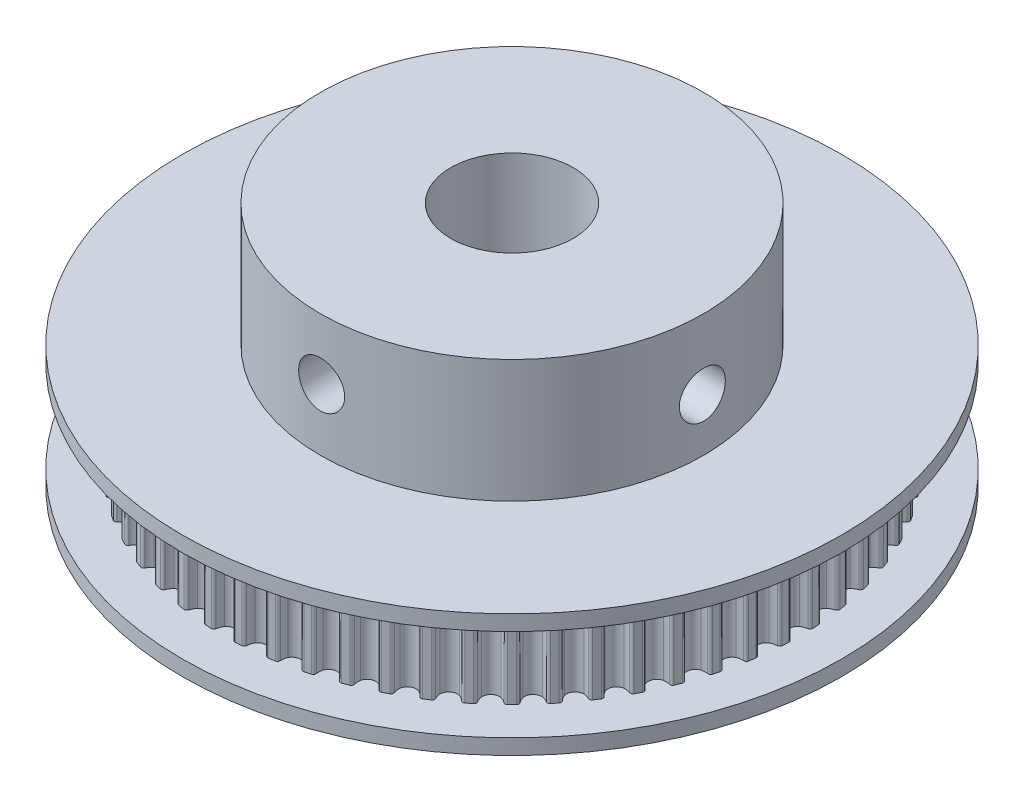
from build123d import *

# Parameters (mm, degrees)
SKETCH1_R                = 18.844609303
BOSS_EXTRUDE1_DEPTH      = 6
CUT_EXTRUDE1_START       = -10
CUT_EXTRUDE1_DEPTH       = 10
FILLET1_R                = 0.17
CIRPATTERN2_COUNT        = 60
FILLET1_OF_CIRPATTERN2_R = 0.17
SKETCH3_R                = 21.5
BOSS_EXTRUDE2_DEPTH      = 1
BOSS_EXTRUDE3_START      = 1
SKETCH4_R                = 21.5
BOSS_EXTRUDE3_DEPTH      = 1
SKETCH5_R                = 12.5
SKETCH5_R_2              = 4
BOSS_EXTRUDE4_DEPTH      = 8
SKETCH6_R                = 4
CUT_EXTRUDE2_DEPTH       = 32.440419981
CUT_EXTRUDE3_REACH       = 44.933
SKETCH7_R                = 1.5
CUT_EXTRUDE4_REACH       = 44.933
SKETCH8_R                = 1.5


with BuildPart() as part:
    # Sketch1 → Boss-Extrude1 (new body)
    with BuildSketch(Plane(origin=(0, 0, 0), x_dir=(1, 0, 0), z_dir=(0, 1, 0))):
        Circle(SKETCH1_R)
    extrude(amount=BOSS_EXTRUDE1_DEPTH)

    # Sketch2 → Cut-Extrude1 (cut)
    with BuildSketch(Plane(origin=(0, 6, 0), x_dir=(1, 0, 0), z_dir=(0, 1, 0)).offset(CUT_EXTRUDE1_START)):
        with BuildLine():
            ThreePointArc((0.453553699, 18.286177496), (0.576034086, 18.548370442), (0.619948996, 18.834409017))
            ThreePointArc((0.619948996, 18.834409017), (0, 18.844609303), (-0.619948996, 18.834409017))
            ThreePointArc((-0.619948996, 18.834409017), (-0.576034086, 18.548370442), (-0.453553699, 18.286177496))
            ThreePointArc((-0.453553699, 18.286177496), (0, 18.064609303), (0.453553699, 18.286177496))
        make_face()
    cut_extrude1 = extrude(amount=CUT_EXTRUDE1_DEPTH, mode=Mode.SUBTRACT)

    # Fillet1
    fillet1_edges = [part.edges().sort_by_distance(p)[0] for p in [
        (0.619948996, 3, -18.834409017),
        (-0.619948996, 3, -18.834409017),
    ]]
    fillet(fillet1_edges, radius=FILLET1_R)

    # CirPattern2: Cut-Extrude1 ×60 about axis
    cirpattern2_axis = Axis((0, 6, 0), (0, -1, 0))
    for i in range(1, CIRPATTERN2_COUNT):
        add(cut_extrude1.rotate(cirpattern2_axis, i * 360 / CIRPATTERN2_COUNT), mode=Mode.SUBTRACT)

    # Fillet1 of CirPattern2
    fillet1_of_cirpattern2_edges = [part.edges().sort_by_distance(p)[0] for p in [
        (2.585284682, 3, -18.666429838),
        (1.352178981, 3, -18.79603447),
        (4.522295447, 3, -18.293937347),
        (3.309492201, 3, -18.551726635),
        (6.409758998, 3, -17.721012651),
        (5.230545933, 3, -18.104162202),
        (8.226995887, 3, -16.953932831),
        (7.094292709, 3, -17.458244778),
        (9.954096088, 3, -16.001102176),
        (8.880312929, 3, -16.621051172),
        (11.572137129, 3, -14.872960097),
        (10.569038583, 3, -15.601753851),
        (13.063391414, 3, -13.581866754),
        (12.141967638, 3, -14.411520449),
        (14.411520449, 3, -12.141967638),
        (13.581866754, 3, -13.063391414),
        (15.601753851, 3, -10.569038583),
        (14.872960097, 3, -11.572137129),
        (16.621051172, 3, -8.880312929),
        (16.001102176, 3, -9.954096088),
        (17.458244778, 3, -7.094292709),
        (16.953932831, 3, -8.226995887),
        (18.104162202, 3, -5.230545933),
        (17.721012651, 3, -6.409758998),
        (18.551726635, 3, -3.309492201),
        (18.293937347, 3, -4.522295447),
        (18.79603447, 3, -1.352178981),
        (18.666429838, 3, -2.585284682),
        (18.834409017, 3, 0.619948996),
        (18.834409017, 3, -0.619948996),
        (18.666429838, 3, 2.585284682),
        (18.79603447, 3, 1.352178981),
        (18.293937347, 3, 4.522295447),
        (18.551726635, 3, 3.309492201),
        (17.721012651, 3, 6.409758998),
        (18.104162202, 3, 5.230545933),
        (16.953932831, 3, 8.226995887),
        (17.458244778, 3, 7.094292709),
        (16.001102176, 3, 9.954096088),
        (16.621051172, 3, 8.880312929),
        (14.872960097, 3, 11.572137129),
        (15.601753851, 3, 10.569038583),
        (13.581866754, 3, 13.063391414),
        (14.411520449, 3, 12.141967638),
        (12.141967638, 3, 14.411520449),
        (13.063391414, 3, 13.581866754),
        (10.569038583, 3, 15.601753851),
        (11.572137129, 3, 14.872960097),
        (8.880312929, 3, 16.621051172),
        (9.954096088, 3, 16.001102176),
        (7.094292709, 3, 17.458244778),
        (8.226995887, 3, 16.953932831),
        (5.230545933, 3, 18.104162202),
        (6.409758998, 3, 17.721012651),
        (3.309492201, 3, 18.551726635),
        (4.522295447, 3, 18.293937347),
        (1.352178981, 3, 18.79603447),
        (2.585284682, 3, 18.666429838),
        (-0.619948996, 3, 18.834409017),
        (0.619948996, 3, 18.834409017),
        (-2.585284682, 3, 18.666429838),
        (-1.352178981, 3, 18.79603447),
        (-4.522295447, 3, 18.293937347),
        (-3.309492201, 3, 18.551726635),
        (-6.409758998, 3, 17.721012651),
        (-5.230545933, 3, 18.104162202),
        (-8.226995887, 3, 16.953932831),
        (-7.094292709, 3, 17.458244778),
        (-9.954096088, 3, 16.001102176),
        (-8.880312929, 3, 16.621051172),
        (-11.572137129, 3, 14.872960097),
        (-10.569038583, 3, 15.601753851),
        (-13.063391414, 3, 13.581866754),
        (-12.141967638, 3, 14.411520449),
        (-14.411520449, 3, 12.141967638),
        (-13.581866754, 3, 13.063391414),
        (-15.601753851, 3, 10.569038583),
        (-14.872960097, 3, 11.572137129),
        (-16.621051172, 3, 8.880312929),
        (-16.001102176, 3, 9.954096088),
        (-17.458244778, 3, 7.094292709),
        (-16.953932831, 3, 8.226995887),
        (-18.104162202, 3, 5.230545933),
        (-17.721012651, 3, 6.409758998),
        (-18.551726635, 3, 3.309492201),
        (-18.293937347, 3, 4.522295447),
        (-18.79603447, 3, 1.352178981),
        (-18.666429838, 3, 2.585284682),
        (-18.834409017, 3, -0.619948996),
        (-18.834409017, 3, 0.619948996),
        (-18.666429838, 3, -2.585284682),
        (-18.79603447, 3, -1.352178981),
        (-18.293937347, 3, -4.522295447),
        (-18.551726635, 3, -3.309492201),
        (-17.721012651, 3, -6.409758998),
        (-18.104162202, 3, -5.230545933),
        (-16.953932831, 3, -8.226995887),
        (-17.458244778, 3, -7.094292709),
        (-16.001102176, 3, -9.954096088),
        (-16.621051172, 3, -8.880312929),
        (-14.872960097, 3, -11.572137129),
        (-15.601753851, 3, -10.569038583),
        (-13.581866754, 3, -13.063391414),
        (-14.411520449, 3, -12.141967638),
        (-12.141967638, 3, -14.411520449),
        (-13.063391414, 3, -13.581866754),
        (-10.569038583, 3, -15.601753851),
        (-11.572137129, 3, -14.872960097),
        (-8.880312929, 3, -16.621051172),
        (-9.954096088, 3, -16.001102176),
        (-7.094292709, 3, -17.458244778),
        (-8.226995887, 3, -16.953932831),
        (-5.230545933, 3, -18.104162202),
        (-6.409758998, 3, -17.721012651),
        (-3.309492201, 3, -18.551726635),
        (-4.522295447, 3, -18.293937347),
        (-1.352178981, 3, -18.79603447),
        (-2.585284682, 3, -18.666429838),
    ]]
    fillet(fillet1_of_cirpattern2_edges, radius=FILLET1_OF_CIRPATTERN2_R)

    # Sketch3 → Boss-Extrude2 (add)
    with BuildSketch(Plane(origin=(0, 6, 0), x_dir=(1, 0, 0), z_dir=(0, 1, 0))):
        Circle(SKETCH3_R)
    extrude(amount=BOSS_EXTRUDE2_DEPTH)

    # Sketch4 → Boss-Extrude3 (add)
    with BuildSketch(Plane.XZ.offset(BOSS_EXTRUDE3_START)):
        Circle(SKETCH4_R)
    extrude(amount=-BOSS_EXTRUDE3_DEPTH)

    # Sketch5 → Boss-Extrude4 (add)
    with BuildSketch(Plane(origin=(0, 7, 0), x_dir=(1, 0, 0), z_dir=(0, 1, 0))):
        Circle(SKETCH5_R)
        Circle(SKETCH5_R_2, mode=Mode.SUBTRACT)
    extrude(amount=BOSS_EXTRUDE4_DEPTH)

    # Sketch6 → Cut-Extrude2 (cut, through all)
    with BuildSketch(Plane(origin=(0, 7, 0), x_dir=(1, 0, 0), z_dir=(0, 1, 0))):
        Circle(SKETCH6_R)
    extrude(amount=-CUT_EXTRUDE2_DEPTH, mode=Mode.SUBTRACT)

    # Sketch7 → Cut-Extrude3 (cut, up to next)
    with BuildSketch(Plane(origin=(12.5, 0, 0), x_dir=(0, 0, -1), z_dir=(1, 0, 0)), mode=Mode.PRIVATE) as cut_extrude3_sk1:
        with Locations((0, 10.429823614)):
            Circle(SKETCH7_R)
    cut_extrude3_tool1 = extrude(cut_extrude3_sk1.sketch, amount=-CUT_EXTRUDE3_REACH, mode=Mode.PRIVATE) & part.part
    add(cut_extrude3_tool1.solids().sort_by_distance((12.5, 10.429824, 0))[0], mode=Mode.SUBTRACT)

    # Sketch8 → Cut-Extrude4 (cut, up to next)
    with BuildSketch(Plane.XY.offset(12.5), mode=Mode.PRIVATE) as cut_extrude4_sk1:
        with Locations((0, 11.0137932)):
            Circle(SKETCH8_R)
    cut_extrude4_tool1 = extrude(cut_extrude4_sk1.sketch, amount=-CUT_EXTRUDE4_REACH, mode=Mode.PRIVATE) & part.part
    add(cut_extrude4_tool1.solids().sort_by_distance((0, 11.013793, 12.5))[0], mode=Mode.SUBTRACT)


solid = part.part
